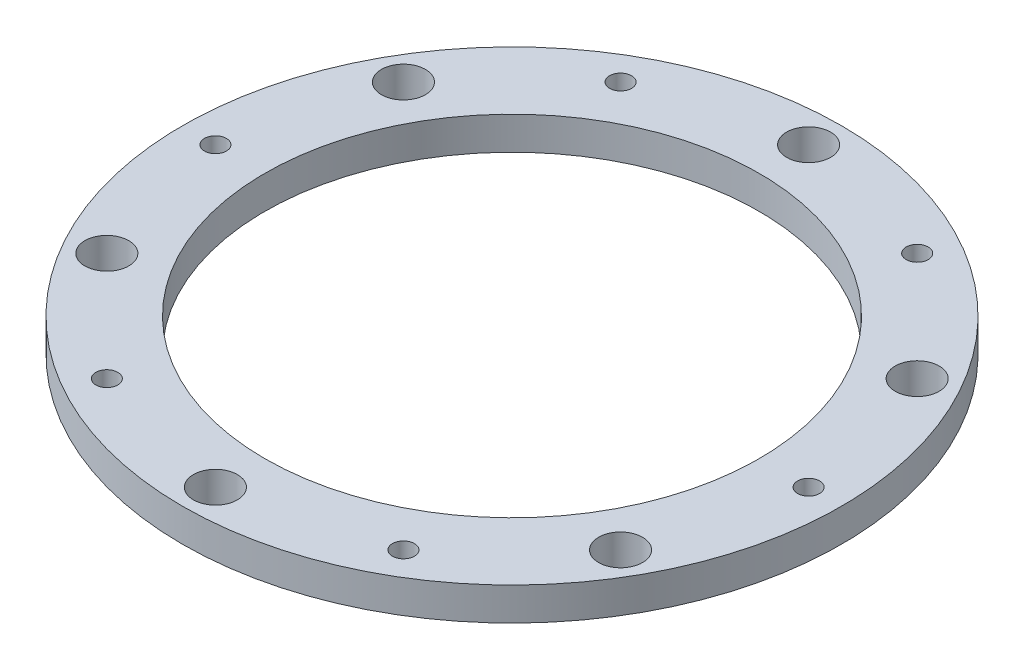
from build123d import *

# Parameters (mm, degrees)
SKETCH1_R           = 30
SKETCH1_R_2         = 2
SKETCH1_R_3         = 22.5
BOSS_EXTRUDE1_DEPTH = 3
SKETCH3_R           = 1
CUT_EXTRUDE1_DEPTH  = 3


with BuildPart() as part:
    # Sketch1 → Boss-Extrude1 (new body)
    with BuildSketch(Plane(origin=(0, 0, 0), x_dir=(1, 0, 0), z_dir=(0, 1, 0))):
        Circle(SKETCH1_R)
        with Locations((0, 27)):
            Circle(SKETCH1_R_2, mode=Mode.SUBTRACT)
        with Locations((23.382685902, 13.5)):
            Circle(SKETCH1_R_2, mode=Mode.SUBTRACT)
        with Locations((23.382685902, -13.5)):
            Circle(SKETCH1_R_2, mode=Mode.SUBTRACT)
        with Locations((0, -27)):
            Circle(SKETCH1_R_2, mode=Mode.SUBTRACT)
        with Locations((-23.382685902, -13.5)):
            Circle(SKETCH1_R_2, mode=Mode.SUBTRACT)
        with Locations((-23.382685902, 13.5)):
            Circle(SKETCH1_R_2, mode=Mode.SUBTRACT)
        Circle(SKETCH1_R_3, mode=Mode.SUBTRACT)
    extrude(amount=BOSS_EXTRUDE1_DEPTH)

    # Sketch3 → Cut-Extrude1 (cut)
    with BuildSketch(Plane(origin=(0, 3, 0), x_dir=(1, 0, 0), z_dir=(0, 1, 0))):
        with Locations((-13.5, 23.382685902)):
            Circle(SKETCH3_R)
        with Locations((13.5, 23.382685902)):
            Circle(SKETCH3_R)
        with Locations((27, 0)):
            Circle(SKETCH3_R)
        with Locations((13.5, -23.382685902)):
            Circle(SKETCH3_R)
        with Locations((-13.5, -23.382685902)):
            Circle(SKETCH3_R)
        with Locations((-27, 0)):
            Circle(SKETCH3_R)
    extrude(amount=-CUT_EXTRUDE1_DEPTH, mode=Mode.SUBTRACT)


solid = part.part
